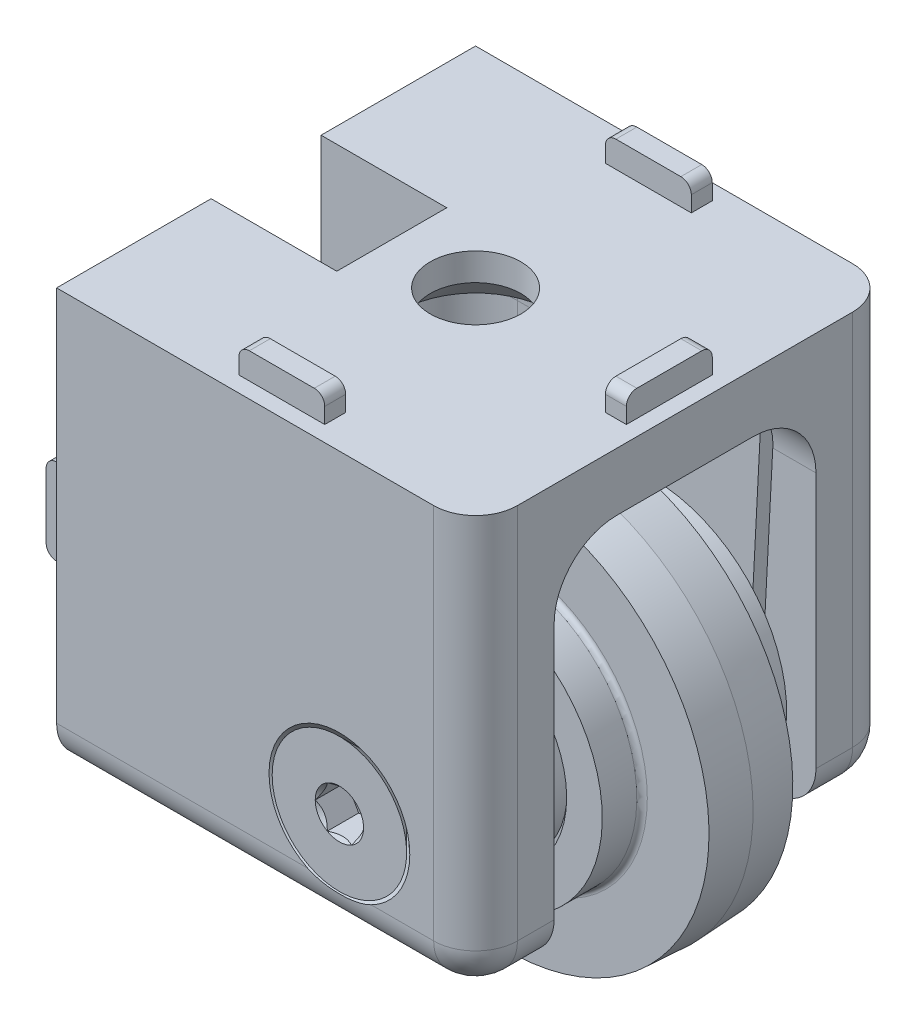
from build123d import *

# Parameters (mm, degrees)
SKETCH3_R           = 9.5
CUT_EXTRUDE1_DEPTH  = 0.55
BOSS_EXTRUDE1_DEPTH = 20
SKETCH6_W           = 25
SKETCH6_H           = 34.45
CUT_EXTRUDE2_DEPTH  = 33.5
SKETCH7_R           = 3
CUT_EXTRUDE3_DEPTH  = 57.824290581
SKETCH12_W          = 12
SKETCH12_H          = 10.5
CUT_EXTRUDE4_DEPTH  = 12
SKETCH15_W          = 8.2
SKETCH15_H          = 2
SKETCH15_W_2        = 2
SKETCH15_H_2        = 8.2
BOSS_EXTRUDE2_DEPTH = 2.5
MIRROR2_START       = -18.5
MIRROR2_OUTLINE_W   = 2.5
MIRROR2_OUTLINE_H   = 8.2
MIRROR2_DEPTH       = 2
MIRROR2_START_2     = -4.1
MIRROR2_2_OUTLINE_W = 2.5
MIRROR2_2_OUTLINE_H = 2
MIRROR2_2_DEPTH     = 8.2
MIRROR2_START_3     = 16.5
MIRROR2_3_OUTLINE_W = 2.5
MIRROR2_3_OUTLINE_H = 8.2
MIRROR2_3_DEPTH     = 2
FILLET1_R           = 1
FILLET2_R           = 4
FILLET3_R           = 6
FILLET4_R           = 5
SKETCH16_R          = 3.3
BOSS_EXTRUDE3_DEPTH = 1.3
SKETCH17_R          = 3
BOSS_EXTRUDE4_DEPTH = 1.3
SKETCH18_R          = 9
SKETCH18_R_2        = 3.2
BOSS_EXTRUDE5_DEPTH = 1.95
BOSS_EXTRUDE6_START = -16.5
SKETCH18_2_R        = 9
SKETCH18_2_R_2      = 3.2
BOSS_EXTRUDE6_DEPTH = 3.95
CUT_EXTRUDE5_DEPTH  = 3


# Read off the part's stored shape, not the designer's step: Mirror2
with BuildPart() as part:
    # Sketch2 → Revolve1 (revolve)
    with BuildSketch(Plane(origin=(0, 0, 0), x_dir=(0, 0, -1), z_dir=(1, 0, 0))):
        with BuildLine():
            Line((-7.3, 3), (9.3, 3))
            ThreePointArc((9.3, 3), (9.653553391, 3.146446609), (9.8, 3.5))
            Line((9.8, 3.5), (9.8, 12.9))
            Line((9.8, 12.9), (4.5, 12.9))
            ThreePointArc((4.5, 12.9), (4.146446609, 13.046446609), (4, 13.4))
            Line((4, 13.4), (4, 19.290368883))
            Line((4, 19.290368883), (0, 19.5))
            Line((0, 19.5), (-4, 19.290368883))
            Line((-4, 19.290368883), (-4, 13.4))
            ThreePointArc((-4, 13.4), (-4.146446609, 13.046446609), (-4.5, 12.9))
            Line((-4.5, 12.9), (-7.8, 12.9))
            Line((-7.8, 12.9), (-7.8, 3.5))
            ThreePointArc((-7.8, 3.5), (-7.653553391, 3.146446609), (-7.3, 3))
        make_face()
    revolve(axis=Axis((0, 0, -9.8), (0, 0, 1)))

    # Sketch3 → Cut-Extrude1 (cut)
    with BuildSketch(Plane.XY.offset(7.8)):
        Circle(SKETCH3_R)
    cut_extrude1 = extrude(amount=-CUT_EXTRUDE1_DEPTH, mode=Mode.SUBTRACT)

    # Mirror1: Cut-Extrude1 across plane
    add(cut_extrude1.mirror(Plane(origin=(0, 0, -1), x_dir=(1, 0, 0), z_dir=(0, 0, -1))), mode=Mode.SUBTRACT)


with BuildPart() as body_2:
    # Sketch5 → Boss-Extrude1 (new, symmetric)
    with BuildSketch(Plane.XY):
        with BuildLine():
            Line((13, 30), (13, -6))
            ThreePointArc((13, -6), (11.828427125, -8.828427125), (9, -10))
            Line((9, -10), (-27, -10))
            Line((-27, -10), (-27, 30))
            Line((-27, 30), (13, 30))
        make_face()
    extrude(amount=BOSS_EXTRUDE1_DEPTH, both=True)

    # Sketch6 → Cut-Extrude2 (cut)
    with BuildSketch(Plane(origin=(13, 0, 0), x_dir=(0, 0, -1), z_dir=(1, 0, 0))):
        with Locations((0, 7.225)):
            Rectangle(SKETCH6_W, SKETCH6_H)
    extrude(amount=-CUT_EXTRUDE2_DEPTH, mode=Mode.SUBTRACT)

    # Sketch7 → Cut-Extrude3 (cut, through all)
    with BuildSketch(Plane(origin=(0, 0, -20), x_dir=(-1, 0, 0), z_dir=(0, 0, -1))):
        Circle(SKETCH7_R)
    extrude(amount=-CUT_EXTRUDE3_DEPTH, mode=Mode.SUBTRACT)


with BuildPart() as csk_for_m6_sfhcs1_tool:
    # Sketch9 → CSK for M6 SFHCS1 (revolve)
    with BuildSketch(Plane(origin=(0, 0, 20), x_dir=(0, -1, 0), z_dir=(1, 0, 0))):
        Polygon((0, 0), (0, 29.8), (3.3, 29.8), (3.3, 3.42), (6.72, 0), align=None)
    revolve(axis=Axis((0, 0, 26.35), (0, 0, -1)))


with BuildPart() as part_1:
    add(part.part)

    # CSK for M6 SFHCS1: cut by csk_for_m6_sfhcs1_tool
    add(csk_for_m6_sfhcs1_tool.part, mode=Mode.SUBTRACT)


with BuildPart() as body_2_1:
    add(body_2.part)

    # CSK for M6 SFHCS1: cut by csk_for_m6_sfhcs1_tool
    add(csk_for_m6_sfhcs1_tool.part, mode=Mode.SUBTRACT)

    # Sketch11 → CSK for M8 Flat Head Machine Screw1 (revolve, cut)
    with BuildSketch(Plane(origin=(-7, 24.45, 0), x_dir=(0, 0, -1), z_dir=(1, 0, 0))):
        Polygon((0, 0), (0, 5.551), (4.325, 5.551), (4.325, 2.925), (7.25, 0), align=None)
    revolve(axis=Axis((-7, 18.1, 0), (0, 1, 0)), mode=Mode.SUBTRACT)

    # Sketch12 → Cut-Extrude4 (cut)
    with BuildSketch(Plane(origin=(0, 30, 0), x_dir=(1, 0, 0), z_dir=(0, 1, 0))):
        with Locations((-21, 0)):
            Rectangle(SKETCH12_W, SKETCH12_H)
    extrude(amount=-CUT_EXTRUDE4_DEPTH, mode=Mode.SUBTRACT)

    # Sketch14 → CSK for M8 Flat Head Machine Screw2 (revolve, cut)
    with BuildSketch(Plane(origin=(-20.5, 10, 0), x_dir=(0, 0, -1), z_dir=(0, 1, 0))):
        Polygon((0, 0), (0, 6.501), (4.175, 6.501), (4.175, 3.85), (8.025, 0), align=None)
    revolve(axis=Axis((-14.15, 10, 0), (-1, 0, 0)), mode=Mode.SUBTRACT)

    # Sketch15 → Boss-Extrude2 (add)
    with BuildSketch(Plane(origin=(0, 30, 0), x_dir=(1, 0, 0), z_dir=(0, 1, 0))):
        with Locations((-7, -17.5)):
            Rectangle(SKETCH15_W, SKETCH15_H)
        with Locations((10.5, 0)):
            Rectangle(SKETCH15_W_2, SKETCH15_H_2)
        with Locations((-7, 17.5)):
            Rectangle(SKETCH15_W, SKETCH15_H)
        with Locations((-24.5, 0)):
            Rectangle(SKETCH15_W_2, SKETCH15_H_2)
    extrude(amount=BOSS_EXTRUDE2_DEPTH)


with BuildPart() as boss_extrude2_piece_1:
    # of the separate pieces the step leaves, piece 1, a body of its own (boss_extrude2_pieces)
    add(body_2_1.part.solids().sort_by_distance((13, 30, -20))[0])

    # Mirror2 outline → Mirror2 (add)
    with BuildSketch(Plane.XY.offset(MIRROR2_START)):
        with Locations((-28.25, 10)):
            Rectangle(MIRROR2_OUTLINE_W, MIRROR2_OUTLINE_H)
    extrude(amount=MIRROR2_DEPTH)

    # Mirror2 2 outline → Mirror2 2 (add)
    with BuildSketch(Plane.XY.offset(MIRROR2_START_2)):
        with Locations((-28.25, -7.5)):
            Rectangle(MIRROR2_2_OUTLINE_W, MIRROR2_2_OUTLINE_H)
    extrude(amount=MIRROR2_2_DEPTH)

    # Mirror2 3 outline → Mirror2 3 (add)
    with BuildSketch(Plane.XY.offset(MIRROR2_START_3)):
        with Locations((-28.25, 10)):
            Rectangle(MIRROR2_3_OUTLINE_W, MIRROR2_3_OUTLINE_H)
    extrude(amount=MIRROR2_3_DEPTH)

    # Fillet1
    fillet1_edges = [boss_extrude2_piece_1.edges().sort_by_distance(p)[0] for p in [
        (10.5, 32.5, 4.1),
        (10.5, 32.5, -4.1),
        (-2.9, 32.5, -17.5),
        (-11.1, 32.5, -17.5),
        (-29.5, 5.9, -17.5),
        (-29.5, 14.1, -17.5),
        (-29.5, 14.1, 17.5),
        (-29.5, 5.9, 17.5),
        (-29.5, -7.5, 4.1),
        (-29.5, -7.5, -4.1),
        (-11.1, 32.5, 17.5),
        (-2.9, 32.5, 17.5),
    ]]
    fillet(fillet1_edges, radius=FILLET1_R)

    # Fillet2
    # the kernel refuses this fillet: 4 mm, written as the material it takes off along each edge
    with BuildSketch(Plane(origin=(9, -10, 20), x_dir=(0, 1, 0), z_dir=(-1, 0, 0))) as fillet2_piece_1:
        with BuildLine():
            CenterArc((FILLET2_R, FILLET2_R), FILLET2_R, 180, 90)
            Line((0, FILLET2_R), (0, 0))
            Line((0, 0), (FILLET2_R, 0))
        make_face()
    extrude(amount=46, mode=Mode.SUBTRACT)
    with BuildSketch(Plane(origin=(9, -6, 20), x_dir=(1, 0, 0), z_dir=(0, 1, 0))) as fillet2_piece_2:
        with BuildLine():
            CenterArc((4 - FILLET2_R, FILLET2_R), FILLET2_R, 270, 90)
            Line((4, FILLET2_R), (4, 0))
            Line((4, 0), (4 - FILLET2_R, 0))
        make_face()
    revolve(axis=Axis((9, -6, 20), (0, 0, -1)), revolution_arc=90, mode=Mode.SUBTRACT)
    with BuildSketch(Plane(origin=(13, 40, 20), x_dir=(0, 0, -1), z_dir=(0, -1, 0)), Plane(origin=(13, 40, -20), x_dir=(-1, 0, 0), z_dir=(0, -1, 0)), Plane(origin=(9, -10, -20), x_dir=(0, 1, 0), z_dir=(-1, 0, 0))) as fillet2_piece_3:
        with BuildLine():
            CenterArc((FILLET2_R, -FILLET2_R), FILLET2_R, 90, 90)
            Line((0, -FILLET2_R), (0, 0))
            Line((0, 0), (FILLET2_R, 0))
        make_face()
    extrude(amount=46, mode=Mode.SUBTRACT)
    with BuildSketch(Plane(origin=(9, -6, -20), x_dir=(1, 0, 0), z_dir=(0, 1, 0))) as fillet2_piece_4:
        with BuildLine():
            CenterArc((4 - FILLET2_R, -FILLET2_R), FILLET2_R, 0, 90)
            Line((4, -FILLET2_R), (4, 0))
            Line((4, 0), (4 - FILLET2_R, 0))
        make_face()
    revolve(axis=Axis((9, -6, -20), (0, 0, -1)), revolution_arc=90, mode=Mode.SUBTRACT)

    # Fillet3
    fillet3_edges = [boss_extrude2_piece_1.edges().sort_by_distance(p)[0] for p in [
        (-3.75, 24.45, -12.5),
        (-3.75, 24.45, 12.5),
    ]]
    fillet(fillet3_edges, radius=FILLET3_R)

    # Fillet4
    fillet4_edges = [boss_extrude2_piece_1.edges().sort_by_distance(p)[0] for p in [
        (-20.5, 4.225, -12.5),
        (-20.5, 24.45, -5.875),
        (-20.5, 4.225, 12.5),
        (-20.5, 22.692640687, 10.742640687),
        (-20.5, 22.692640687, -10.742640687),
        (-20.5, 24.45, 5.875),
    ]]
    fillet(fillet4_edges, radius=FILLET4_R)

    # Sketch16 → Boss-Extrude3 (add)
    with BuildSketch(Plane(origin=(0, 0, 12.5), x_dir=(-1, 0, 0), z_dir=(0, 0, -1))):
        with BuildLine():
            Line((-9.192211737, 24.45), (9.192211737, 24.45))
            Line((9.192211737, 24.45), (7.889173325, -0.413454054))
            ThreePointArc((7.889173325, -0.413454054), (0, -7.9), (-7.889173325, -0.413454054))
            Line((-7.889173325, -0.413454054), (-9.192211737, 24.45))
        make_face()
        with Locations(Location((0, 0, 0), (0, 0, 180))):
            Circle(SKETCH16_R, mode=Mode.SUBTRACT)
    extrude(amount=BOSS_EXTRUDE3_DEPTH)

    # Sketch17 → Boss-Extrude4 (add)
    with BuildSketch(Plane.XY.offset(-12.5)):
        with BuildLine():
            Line((-9.192211737, 24.45), (-7.889173325, -0.413454054))
            ThreePointArc((-7.889173325, -0.413454054), (0, -7.9), (7.889173325, -0.413454054))
            Line((7.889173325, -0.413454054), (9.192211737, 24.45))
            Line((9.192211737, 24.45), (-9.192211737, 24.45))
        make_face()
        with Locations(Location((0, 0, 0), (0, 0, 180))):
            Circle(SKETCH17_R, mode=Mode.SUBTRACT)
    extrude(amount=BOSS_EXTRUDE4_DEPTH)


with BuildPart() as boss_extrude2_piece_2:
    # of the separate pieces the step leaves, piece 2, a body of its own (boss_extrude2_pieces)
    add(body_2_1.part.solids().sort_by_distance((-25.5, 30, -4.1))[0])


with BuildPart() as body_3:
    # Sketch18 → Boss-Extrude5 (new body)
    with BuildSketch(Plane(origin=(0, 0, -9.25), x_dir=(-1, 0, 0), z_dir=(0, 0, -1))):
        with Locations(Location((0, 0, 0), (0, 0, 270))):
            Circle(SKETCH18_R)
        with Locations(Location((0, 0, 0), (0, 0, 270))):
            Circle(SKETCH18_R_2, mode=Mode.SUBTRACT)
    extrude(amount=BOSS_EXTRUDE5_DEPTH)


with BuildPart() as body_4:
    # Sketch18<2> → Boss-Extrude6 (new body)
    with BuildSketch(Plane(origin=(0, 0, -9.25), x_dir=(-1, 0, 0), z_dir=(0, 0, -1)).offset(BOSS_EXTRUDE6_START)):
        Circle(SKETCH18_2_R)
        Circle(SKETCH18_2_R_2, mode=Mode.SUBTRACT)
    extrude(amount=-BOSS_EXTRUDE6_DEPTH)


with BuildPart() as body_5:
    # Sketch19 → Revolve2 (revolve)
    with BuildSketch(Plane(origin=(0, 0, 0), x_dir=(0, 0, -1), z_dir=(1, 0, 0)), mode=Mode.PRIVATE) as revolve2_sk:
        Polygon((19, 3), (-16.58, 3), (-20, 6.42), (-20, 0), (20, 0), (20, 2), align=None)
    revolve(revolve2_sk.sketch.rotate(Axis((0, 0, -20), (0, 0, 1)), 90), axis=Axis((0, 0, -20), (0, 0, 1)))

    # Sketch20 → Cut-Extrude5 (cut)
    with BuildSketch(Plane.XY.offset(20)):
        Polygon((-1.154700538, 2), (-2.309401077, 0), (-1.154700538, -2), (1.154700538, -2), (2.309401077, 0), (1.154700538, 2), align=None)
    extrude(amount=-CUT_EXTRUDE5_DEPTH, mode=Mode.SUBTRACT)

    # Cut-Extrude6 cone 1 section (through the dimple's axis) → Cut-Extrude6 (revolve, cut)
    with BuildSketch(Plane(origin=(0, 0, 20), x_dir=(0, -1, 0), z_dir=(1, 0, 0))):
        Polygon((0, 0), (2.309401077, 0), (0, 2.309401077), align=None)
    revolve(axis=Axis((0, 0, 20), (0, 0, -1)), mode=Mode.SUBTRACT)


solid = Compound([part_1.part, boss_extrude2_piece_1.part, body_3.part, body_4.part, body_5.part])
